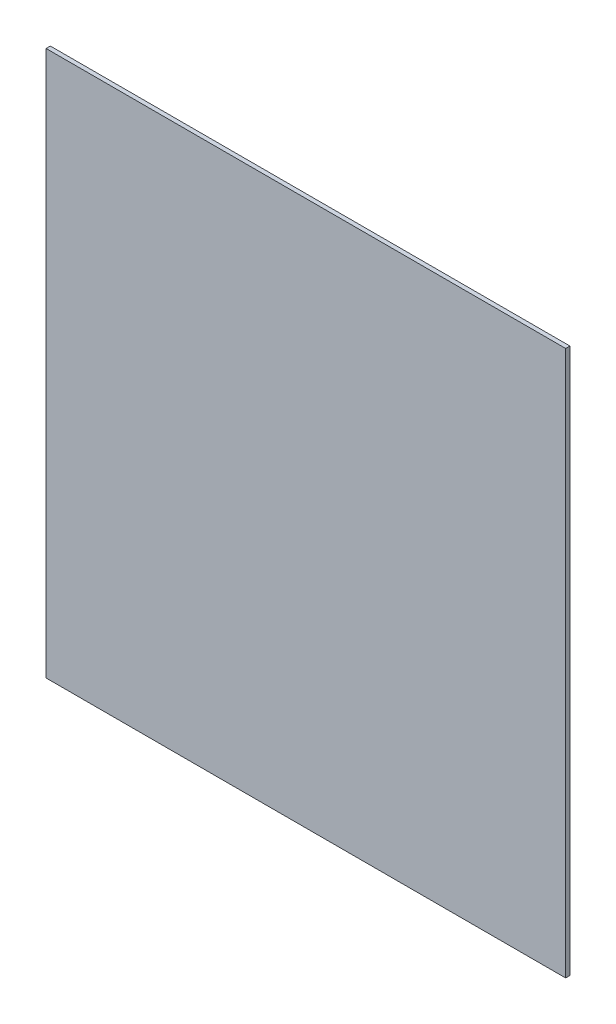
from build123d import *

# Parameters (mm, degrees)
SKETCH1_W           = 193.675
SKETCH1_H           = 203.2
BOSS_EXTRUDE1_DEPTH = 1.5875


with BuildPart() as part:
    # Sketch1 → Boss-Extrude1 (new body)
    with BuildSketch(Plane.XY):
        with Locations((96.8375, 101.6)):
            Rectangle(SKETCH1_W, SKETCH1_H)
    extrude(amount=BOSS_EXTRUDE1_DEPTH)


solid = part.part
